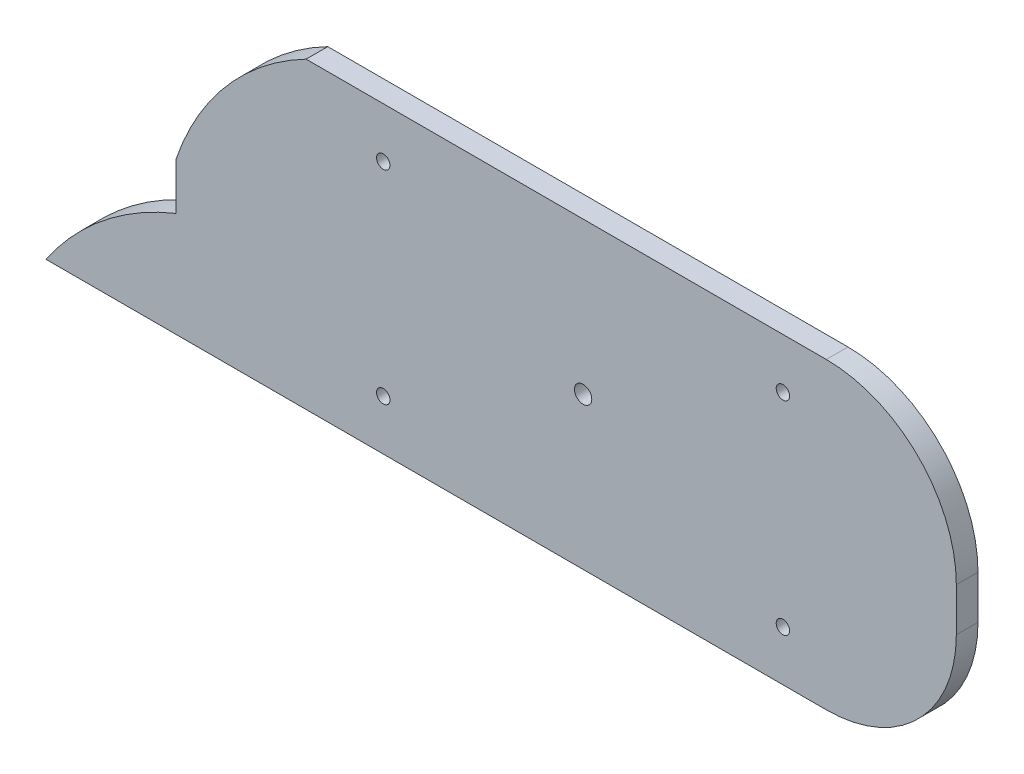
from build123d import *

# Parameters (mm, degrees)
BOSS_EXTRUDE1_DEPTH = 12.7
SKETCH4_R           = 5.08
SKETCH4_R_2         = 3.937
CUT_EXTRUDE2_DEPTH  = 563.396381567


with BuildPart() as part:
    # Sketch2 → Boss-Extrude1 (new body)
    with BuildSketch(Plane.XY):
        with BuildLine():
            Line((0, 0), (457.2, 0))
            ThreePointArc((457.2, 0), (511.081536726, 22.318463274), (533.4, 76.2))
            Line((533.4, 76.2), (533.4, 101.6))
            ThreePointArc((533.4, 101.6), (511.081536726, 155.481536726), (457.2, 177.8))
            Line((457.2, 177.8), (152.4, 177.8))
            ThreePointArc((152.4, 177.8), (105.657968509, 140.757455564), (76.2, 88.9))
            Line((76.2, 88.9), (76.2, 61.401251199))
            ThreePointArc((76.2, 61.401251199), (33.506060073, 36.401783403), (0, 0))
        make_face()
    extrude(amount=BOSS_EXTRUDE1_DEPTH)

    # Sketch4 → Cut-Extrude2 (cut, through all)
    with BuildSketch(Plane.XY.offset(12.7)):
        with Locations((314.706, 88.9)):
            Circle(SKETCH4_R)
        with Locations((431.8, 148.4376)):
            Circle(SKETCH4_R_2)
        with Locations((197.612, 148.4376)):
            Circle(SKETCH4_R_2)
        with Locations((197.612, 29.3624)):
            Circle(SKETCH4_R_2)
        with Locations((431.8, 29.3624)):
            Circle(SKETCH4_R_2)
    extrude(amount=-CUT_EXTRUDE2_DEPTH, mode=Mode.SUBTRACT)


solid = part.part
